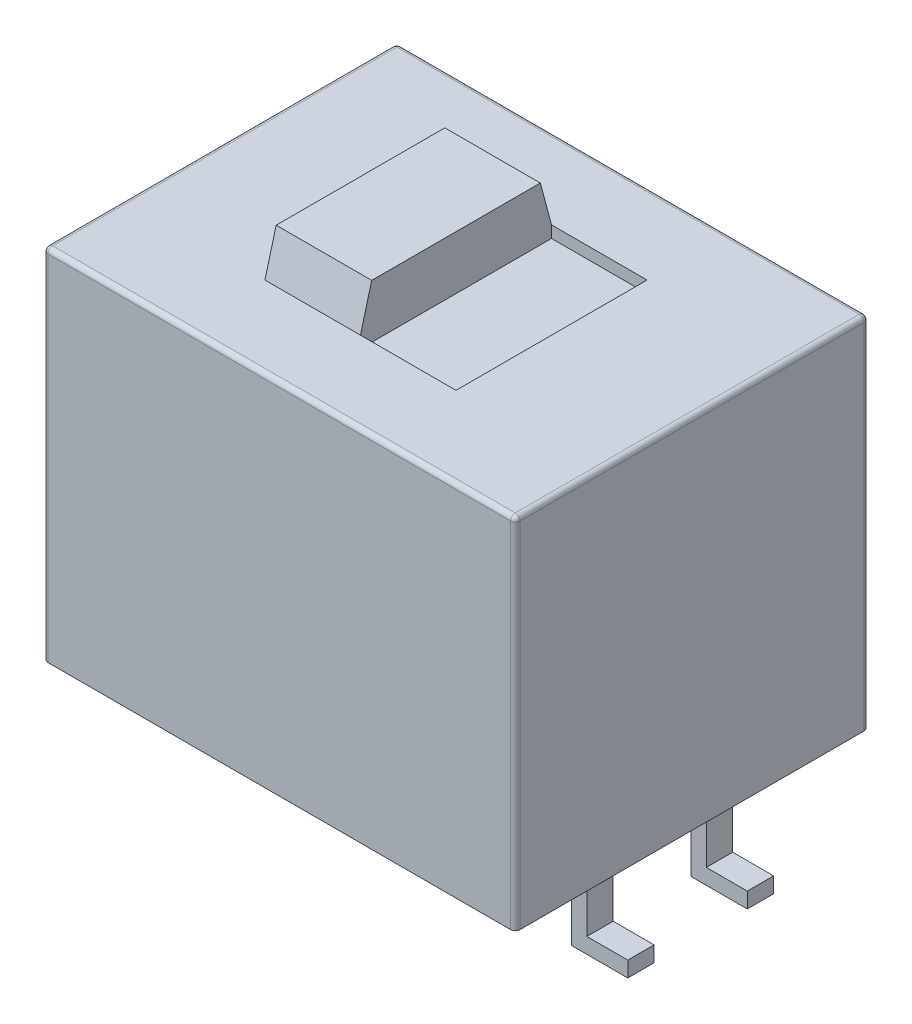
from build123d import *
from OCP.BRepFilletAPI import BRepFilletAPI_MakeChamfer

# Parameters (mm, degrees)
SKETCH1_W           = 10.03
SKETCH1_H           = 7.51
BOSS_EXTRUDE1_DEPTH = 7.62
SKETCH2_W           = 2.03
SKETCH2_H           = 4.06
BOSS_EXTRUDE2_DEPTH = 0.89
CHAMFER1_SIZE       = 0.89
CHAMFER1_SIZE_2     = 0.238474781
SKETCH3_W           = 2.03
SKETCH3_H           = 4.06
CUT_EXTRUDE1_DEPTH  = 0.25
BOSS_EXTRUDE3_DEPTH = 0.28
LPATTERN1_COUNT     = 2
LPATTERN1_PITCH     = 2.54
FILLET1_R           = 0.1


with BuildPart() as part:
    # Sketch1 → Boss-Extrude1 (new body)
    with BuildSketch(Plane(origin=(0, 0, 0), x_dir=(1, 0, 0), z_dir=(0, 1, 0))):
        Rectangle(SKETCH1_W, SKETCH1_H)
    extrude(amount=BOSS_EXTRUDE1_DEPTH)

    # Sketch2 → Boss-Extrude2 (add)
    with BuildSketch(Plane(origin=(0, 7.62, 0), x_dir=(1, 0, 0), z_dir=(0, 1, 0))):
        with Locations((-1.015, 0)):
            Rectangle(SKETCH2_W, SKETCH2_H)
    extrude(amount=BOSS_EXTRUDE2_DEPTH)

    # Chamfer1
    chamfer1_edges_1 = [part.edges().sort_by_distance(p)[0] for p in [
        (-1.015, 8.51, -2.03),
    ]]
    chamfer1_side_1 = [part.faces().sort_by_distance(p)[0] for p in [
        (-1.015, 8.505230504, -2.03),
    ]]
    chamfer1_edges_2 = [part.edges().sort_by_distance(p)[0] for p in [
        (-1.015, 8.51, 2.03),
    ]]
    chamfer1_side_2 = [part.faces().sort_by_distance(p)[0] for p in [
        (-1.015, 8.505230504, 2.03),
    ]]
    chamfer1 = BRepFilletAPI_MakeChamfer(part.part.solid().wrapped)
    for e in chamfer1_edges_1:
        chamfer1.Add(CHAMFER1_SIZE - 0.0001, CHAMFER1_SIZE_2 - 0.0001, e.wrapped, chamfer1_side_1[0].wrapped)
    for e in chamfer1_edges_2:
        chamfer1.Add(CHAMFER1_SIZE - 0.0001, CHAMFER1_SIZE_2 - 0.0001, e.wrapped, chamfer1_side_2[0].wrapped)
    add(Compound.cast(chamfer1.Shape()), mode=Mode.REPLACE)  # a hair under: the kernel refuses the full size

    # Sketch3 → Cut-Extrude1 (cut)
    with BuildSketch(Plane(origin=(0, 7.62, 0), x_dir=(1, 0, 0), z_dir=(0, 1, 0))):
        with Locations((1.015, 0)):
            Rectangle(SKETCH3_W, SKETCH3_H)
    extrude(amount=-CUT_EXTRUDE1_DEPTH, mode=Mode.SUBTRACT)

    # Sketch4 → Boss-Extrude3 (add, symmetric)
    with BuildSketch(Plane.XY.offset(1.27)):
        Polygon((4.33, 0), (4, 0), (4, -1.85), (5.2, -1.85), (5.2, -1.52), (4.33, -1.52), align=None)
        Polygon((-4, -1.85), (-5.2, -1.85), (-5.2, -1.52), (-4.33, -1.52), (-4.33, 0), (-4, 0), align=None)
    boss_extrude3 = extrude(amount=BOSS_EXTRUDE3_DEPTH, both=True)

    # LPattern1: Boss-Extrude3 ×2
    with Locations(*[(0, 0, -i * LPATTERN1_PITCH) for i in range(1, LPATTERN1_COUNT)]):
        add(boss_extrude3)

    # Fillet1
    fillet1_edges = [part.edges().sort_by_distance(p)[0] for p in [
        (5.015, 7.62, 0),
        (0, 7.62, -3.755),
        (-5.015, 7.62, 0),
        (0, 7.62, 3.755),
        (-5.015, 3.81, -3.755),
        (5.015, 3.81, -3.755),
        (5.015, 3.81, 3.755),
        (-5.015, 3.81, 3.755),
    ]]
    fillet(fillet1_edges, radius=FILLET1_R)


solid = part.part
